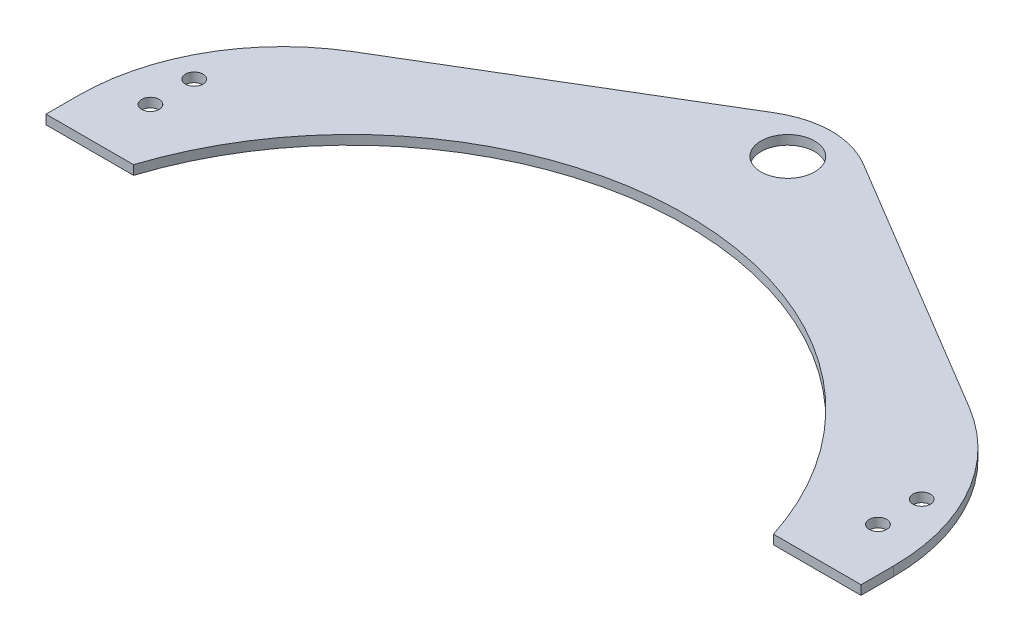
from build123d import *

# Parameters (mm, degrees)
SKETCH1_R           = 4.6
SKETCH1_R_2         = 1.5
BOSS_EXTRUDE2_DEPTH = 1.5875


with BuildPart() as part:
    # Sketch1 → Boss-Extrude2 (new body)
    with BuildSketch(Plane(origin=(0, 0, 0), x_dir=(1, 0, 0), z_dir=(0, 1, 0))):
        with BuildLine():
            Line((109.700000056, 0), (117.200000056, 0))
            Line((117.200000056, 0), (124.700000056, 0))
            Line((124.700000056, 0), (124.700000056, 5.554920326))
            ThreePointArc((124.700000056, 5.554920326), (120.146392707, 22.818094267), (107.670447225, 35.589284453))
            Line((107.670447225, 35.589284453), (62.40678526, 62.67187034))
            ThreePointArc((62.40678526, 62.67187034), (58.77003956, 64.238725538), (54.850000028, 64.799300745))
            ThreePointArc((54.850000028, 64.799300745), (50.929960496, 64.238725538), (47.293214796, 62.67187034))
            Line((47.293214796, 62.67187034), (2.029552831, 35.589284453))
            ThreePointArc((2.029552831, 35.589284453), (-10.446392651, 22.818094267), (-15, 5.554920326))
            Line((-15, 5.554920326), (-15, 0))
            Line((-15, 0), (-7.5, 0))
            Line((-7.5, 0), (0, 0))
            ThreePointArc((0, 0), (54.850000028, 39.949878845), (109.700000056, 0))
        make_face()
        with Locations((54.850000028, 57.3)):
            Circle(SKETCH1_R, mode=Mode.SUBTRACT)
        with BuildLine():
            ThreePointArc((117.200000056, 8.9), (115.700000056, 10.4), (117.200000056, 11.9))
            ThreePointArc((117.200000056, 11.9), (118.700000056, 10.4), (117.200000056, 8.9))
        make_face(mode=Mode.SUBTRACT)
        with Locations((117.200000056, 17.9)):
            Circle(SKETCH1_R_2, mode=Mode.SUBTRACT)
        with BuildLine():
            ThreePointArc((-7.5, 8.9), (-9, 10.4), (-7.5, 11.9))
            ThreePointArc((-7.5, 11.9), (-6, 10.4), (-7.5, 8.9))
        make_face(mode=Mode.SUBTRACT)
        with Locations((-7.5, 17.9)):
            Circle(SKETCH1_R_2, mode=Mode.SUBTRACT)
    extrude(amount=BOSS_EXTRUDE2_DEPTH)


solid = part.part
